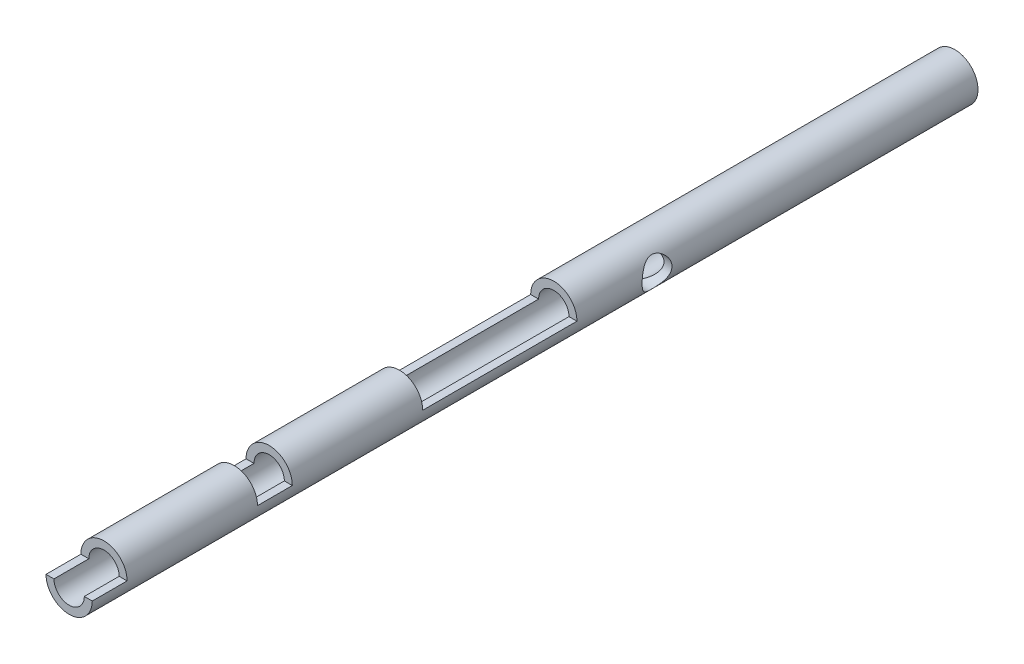
from build123d import *

# Parameters (mm, degrees)
SKETCH2_R               = 4.65
SKETCH2_R_2             = 3.05
BOSS_EXTRUDE1_DEPTH     = 178
CUT_EXTRUDE1_DEPTH      = 179.121433298
CUT_EXTRUDE1_DEPTH_BACK = 179.121433298
SKETCH4_W               = 7
SKETCH4_H               = 4.65
SKETCH4_W_2             = 31
CUT_EXTRUDE2_DEPTH      = 179.121433298
CUT_EXTRUDE2_DEPTH_BACK = 179.121433298
SKETCH5_R               = 3


with BuildPart() as part:
    # Sketch2 → Boss-Extrude1 (new body)
    with BuildSketch(Plane.XY):
        Circle(SKETCH2_R)
        Circle(SKETCH2_R_2, mode=Mode.SUBTRACT)
    extrude(amount=-BOSS_EXTRUDE1_DEPTH)

    # Sketch4 → Cut-Extrude1 (cut, two sides: drawn at the far end of the back side and taken through both)
    with BuildSketch(Plane(origin=(0, 0, 0), x_dir=(0, 0, -1), z_dir=(1, 0, 0)).offset(-CUT_EXTRUDE1_DEPTH_BACK)):
        with Locations((3.5, 2.325)):
            Rectangle(SKETCH4_W, SKETCH4_H)
        with Locations((36.7, 2.325)):
            Rectangle(SKETCH4_W, SKETCH4_H)
        with Locations((81.9, 2.325)):
            Rectangle(SKETCH4_W_2, SKETCH4_H)
    extrude(amount=CUT_EXTRUDE1_DEPTH + CUT_EXTRUDE1_DEPTH_BACK, mode=Mode.SUBTRACT)

    # Sketch5 → Cut-Extrude2 (cut, two sides: drawn at the far end of the back side and taken through both)
    with BuildSketch(Plane(origin=(0, 0, 0), x_dir=(0, 0, -1), z_dir=(1, 0, 0)).offset(-CUT_EXTRUDE2_DEPTH_BACK)):
        with Locations((113.5, 0)):
            Circle(SKETCH5_R)
    extrude(amount=CUT_EXTRUDE2_DEPTH + CUT_EXTRUDE2_DEPTH_BACK, mode=Mode.SUBTRACT)


solid = part.part
